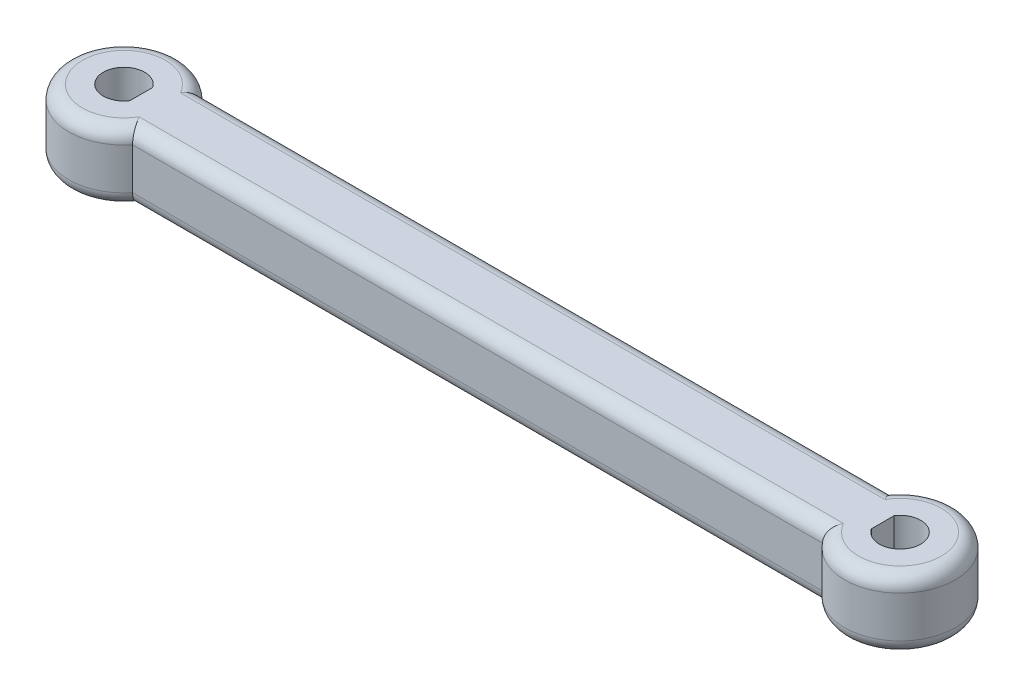
from build123d import *

# Parameters (mm, degrees)
RESSALTO_EXTRUS_O1_DEPTH = 10
FILETE1_R                = 2


with BuildPart() as part:
    # Esboço1 → Ressalto-extrusão1 (new body)
    with BuildSketch(Plane(origin=(0, 0, 0), x_dir=(1, 0, 0), z_dir=(0, 1, 0))):
        with BuildLine():
            Line((6.244997998, 5), (106.244997998, 5))
            ThreePointArc((106.244997998, 5), (120.489995997, 0), (106.244997998, -5))
            Line((106.244997998, -5), (6.244997998, -5))
            ThreePointArc((6.244997998, -5), (-8, 0), (6.244997998, 5))
        make_face()
        with BuildLine():
            Line((2.500066849, 1.658211611), (2.500066849, -1.658211611))
            ThreePointArc((2.500066849, -1.658211611), (-3, 0), (2.500066849, 1.658211611))
        make_face(mode=Mode.SUBTRACT)
        with BuildLine():
            Line((109.989929147, 1.658211611), (109.989929147, -1.658211611))
            ThreePointArc((109.989929147, -1.658211611), (115.489995997, 0), (109.989929147, 1.658211611))
        make_face(mode=Mode.SUBTRACT)
    extrude(amount=RESSALTO_EXTRUS_O1_DEPTH)

    # Filete1
    filete1_edges = [part.edges().sort_by_distance(p)[0] for p in [
        (120.489995997, 0, 0),
        (56.244997998, 0, 5),
        (-8, 0, 0),
        (56.244997998, 0, -5),
        (120.489995997, 10, 0),
        (56.244997998, 10, 5),
        (56.244997998, 10, -5),
        (-8, 10, 0),
    ]]
    fillet(filete1_edges, radius=FILETE1_R)


solid = part.part
